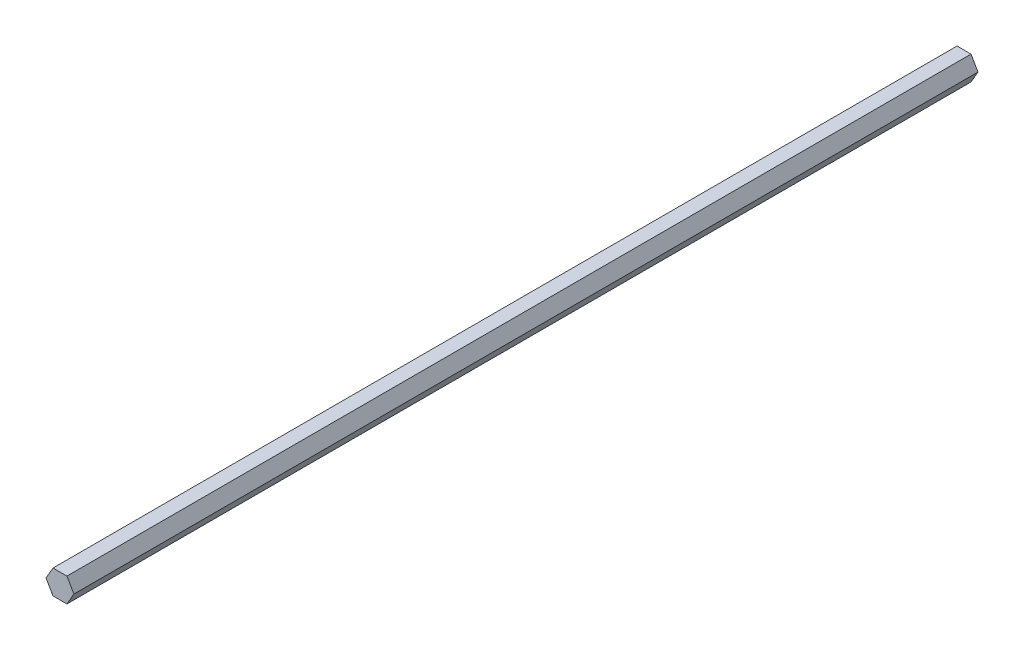
from build123d import *

# Parameters (mm, degrees)
BOSS_EXTRUDE1_DEPTH = 475


with BuildPart() as part:
    # Sketch1 → Boss-Extrude1 (new body)
    with BuildSketch(Plane.XY):
        Polygon((3.666174209, -6.35), (7.332348419, 0), (3.666174209, 6.35), (-3.666174209, 6.35), (-7.332348419, 0), (-3.666174209, -6.35), align=None)
    extrude(amount=BOSS_EXTRUDE1_DEPTH)


solid = part.part
